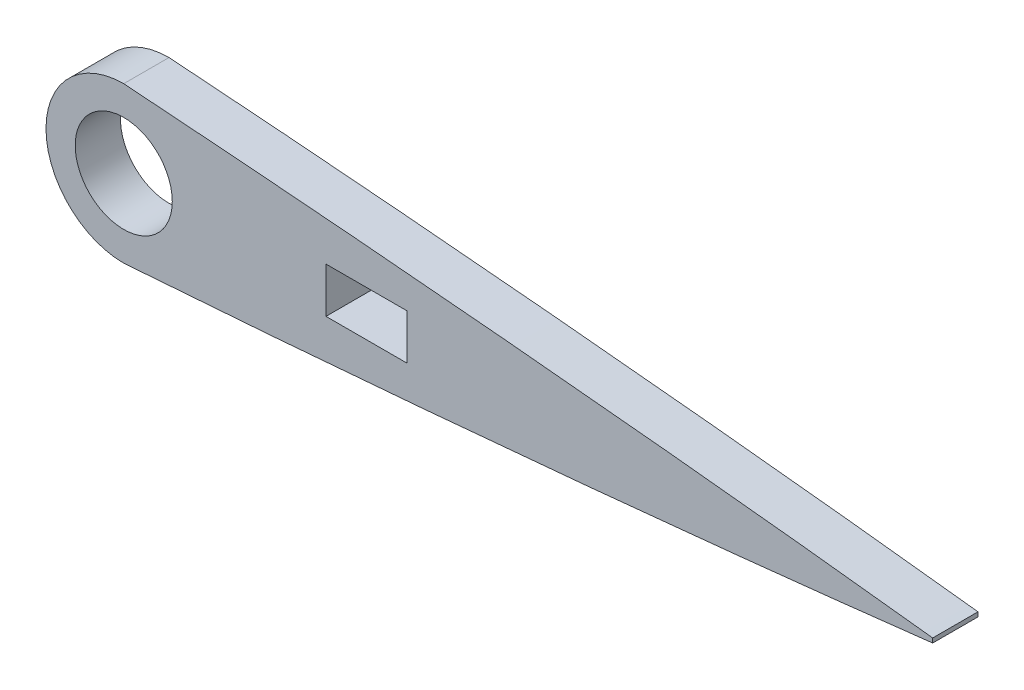
from build123d import *

# Parameters (mm, degrees)
SKETCH_1_R      = 3
SKETCH_1_W      = 5
SKETCH_1_H      = 2.8
EXTRUDE_1_DEPTH = 1.4


with BuildPart() as part:
    # Эскиз1 → Бобышка-Вытянуть1 (new, symmetric)
    with BuildSketch(Plane.XY):
        with BuildLine():
            Line((200, -0.1365), (200, 0.1365))
            add(Edge.make_bspline(
                [(200, 0.1365), (199.68803342, 0.172881569), (198.81669122, 0.27449757), (197.235914613, 0.456098486), (195.145010046, 0.692291497), (192.701519493, 0.962451868), (189.981579718, 1.256111468), (187.036509642, 1.566007991), (183.904963565, 1.886673282), (179.441732645, 2.330723386), (174.819068239, 2.769921708), (170.064960651, 3.20022732), (166.382173561, 3.522091337), (162.644406173, 3.836797902), (158.865943793, 4.14237985), (155.059961592, 4.437010481), (152.101523013, 4.655245952), (150.413140573, 4.775462142), (150, 4.804613846)],
                knots=[0, 0, 0, 0, 0.007144724, 0.019955661, 0.036196061, 0.055011184, 0.075878938, 0.098428866, 0.122375554, 0.147487885, 0.200459747, 0.22800517, 0.256076454, 0.284555151, 0.313332763, 0.342309554, 0.371392651, 0.380814152, 0.380814152, 0.380814152, 0.380814152], degree=3))
            ThreePointArc((150, 4.804613846), (145.195386154, 0), (150, -4.804613846))
            add(Edge.make_bspline(
                [(150, -4.804613846), (150.413140573, -4.775462142), (152.101523013, -4.655245952), (155.059961592, -4.437010481), (158.865943793, -4.14237985), (162.644406173, -3.836797902), (166.382173561, -3.522091337), (170.064960651, -3.20022732), (174.819068239, -2.769921708), (179.441732645, -2.330723386), (183.904963565, -1.886673282), (187.036509642, -1.566007991), (189.981579718, -1.256111468), (192.701519493, -0.962451868), (195.145010046, -0.692291497), (197.235914613, -0.456098486), (198.81669122, -0.27449757), (199.68803342, -0.172881569), (200, -0.1365)],
                knots=[0.619185848, 0.619185848, 0.619185848, 0.619185848, 0.628607349, 0.657690446, 0.686667237, 0.715444849, 0.743923546, 0.77199483, 0.799540253, 0.852512115, 0.877624446, 0.901571134, 0.924121062, 0.944988816, 0.963803939, 0.980044339, 0.992855276, 1, 1, 1, 1], degree=3))
        make_face()
        with Locations((150, 0)):
            Circle(SKETCH_1_R, mode=Mode.SUBTRACT)
        with Locations((165, 0)):
            Rectangle(SKETCH_1_W, SKETCH_1_H, mode=Mode.SUBTRACT)
    extrude(amount=EXTRUDE_1_DEPTH, both=True)


solid = part.part
